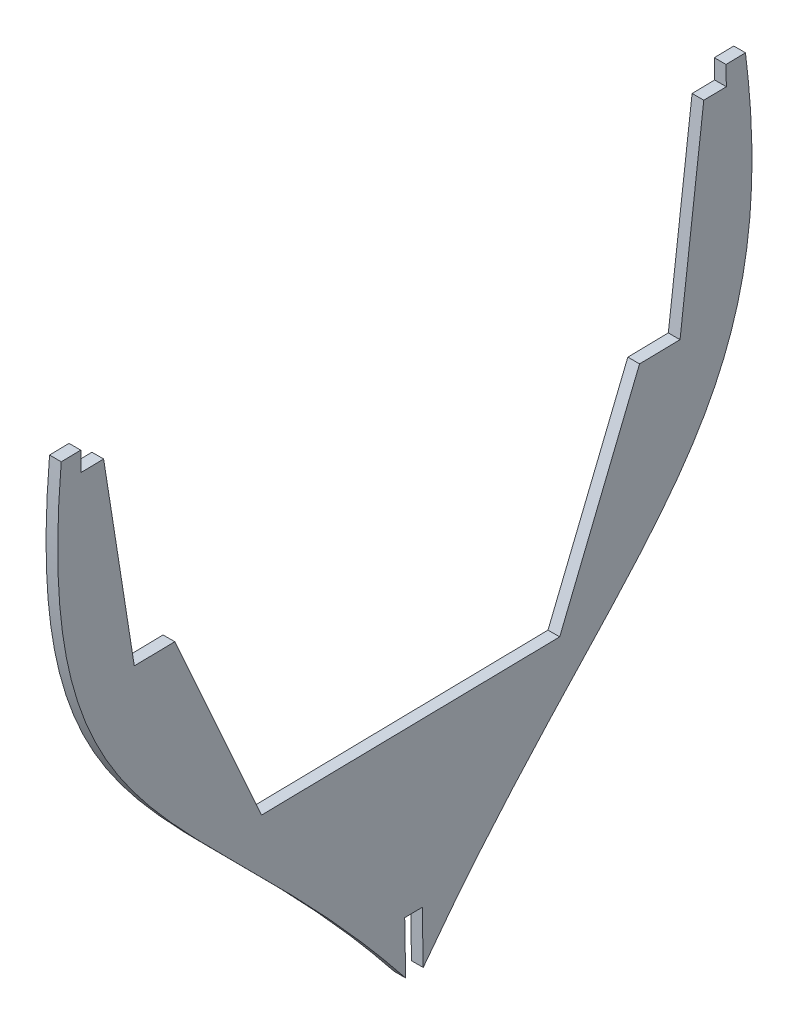
from build123d import *

# Parameters (mm, degrees)
BOSS_EXTRU_3_DEPTH      = 6
ENL_V_MAT_EXTRU_1_DEPTH = 6


with BuildPart() as part:
    # Esquisse2 → Boss.-Extru.3 (new body)
    with BuildSketch(Plane(origin=(0, 0, 0), x_dir=(0, 0, -1), z_dir=(1, 0, 0))):
        with BuildLine():
            Line((169.118479446, 358.567585275), (159.120043042, 358.390753466))
            Line((159.120043042, 358.390753466), (159.296874851, 348.392317063))
            Line((159.296874851, 348.392317063), (147.741412844, 348.187947783))
            Line((147.741412844, 348.187947783), (135.556412402, 247.956806109))
            Line((135.556412402, 247.956806109), (114.797246142, 247.58966061))
            Line((114.797246142, 247.58966061), (73.866403688, 146.85012152))
            Line((73.866403688, 146.85012152), (-79.012950848, 144.146305477))
            Line((-79.012950848, 144.146305477), (-123.480429473, 243.375494453))
            Line((-123.480429473, 243.375494453), (-144.239595733, 243.008348955))
            Line((-144.239595733, 243.008348955), (-159.961232346, 342.745935347))
            Line((-159.961232346, 342.745935347), (-171.516694354, 342.541566067))
            Line((-171.516694354, 342.541566067), (-171.693526162, 352.54000247))
            Line((-171.693526162, 352.54000247), (-181.691962566, 352.363170662))
            add(Edge.make_bspline(
                [(-181.691962566, 352.363170662), (-197.112837589, 179.578592705), (-111.683380442, 171.720879525), (-0.513088754, 29.011099953)],
                knots=[0, 0, 0, 0, 1, 1, 1, 1], degree=3))
            add(Edge.make_bspline(
                [(169.118479446, 358.567585275), (190.639516817, 186.436359994), (105.541341653, 175.562704279), (-0.513088754, 29.011099953)],
                knots=[0, 0, 0, 0, 1, 1, 1, 1], degree=3))
        make_face()
    extrude(amount=BOSS_EXTRU_3_DEPTH)

    # Esquisse3 → Enlèv. mat.-Extru.1 (cut)
    with BuildSketch(Plane(origin=(6, 0, 0), x_dir=(0, 0, -1), z_dir=(1, 0, 0))):
        Polygon((-5.117306858, 34.864016984), (-5.594752741, 61.859795273), (3.403840022, 62.018943901), (3.881285905, 35.023165612), (30.217281857, 21.704466902), (-20.544911126, 12.606032282), align=None)
    extrude(amount=-ENL_V_MAT_EXTRU_1_DEPTH, mode=Mode.SUBTRACT)


solid = part.part
